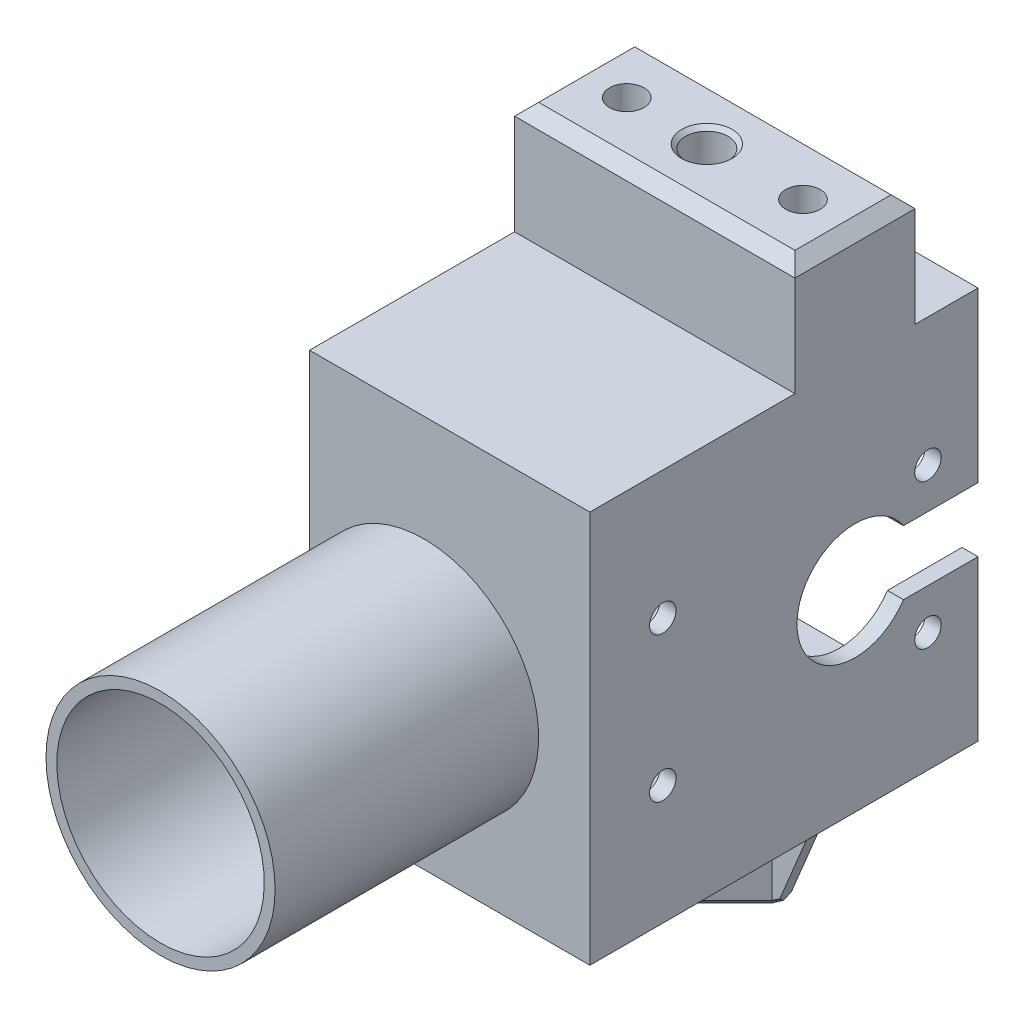
from build123d import *

# Parameters (mm, degrees)
EXTRUDE_1_DEPTH          = 46.45
CUT_EXTRUDE_2_REACH      = 65.11
SKETCH_2_R               = 7.249999999999959
SKETCH_2_R_2             = 5.749999999999962
CUT_EXTRUDE_3_REACH      = 71.748
SKETCH_3_R               = 2.2500000000000027
SKETCH_3_R_2             = 2.249999999999999
SKETCH_4_R               = 12.949999999999998
EXTRUDE_4_DEPTH          = 2
CUT_EXTRUDE_4_DEPTH      = 2
EXTRUDE_5_DEPTH          = 34.9
EXTRUDE_6_DEPTH          = 14
CUT_EXTRUDE_6_REACH      = 106.37
SKETCH_8_R               = 2.649999999999999
SKETCH_8_R_2             = 2.149999999999999
CHAMFER_1_SIZE           = 0.5
EXTRUDE_7_DEPTH          = 15
CUT_EXTRUDE_7_REACH      = 91.85
CUT_EXTRUDE_8_REACH      = 116.053
SKETCH_11_R              = 2.6499999999999995
CHAMFER_4_SIZE           = 1
EXTRUDE_8_DEPTH          = 14
CUT_EXTRUDE_9_REACH      = 94.45
CHAMFER_START            = 24.687020867
CHAMFER_7_DEPTH          = 0.339896844
CHAMFER_START_2          = -25.99805155
CHAMFER_8_DEPTH          = 0.339896844
CHAMFER_2_SIZE           = 0.25
CHAMFER_3_SIZE           = 1.5
CHAMFER_6_SIZE           = 1
SKETCH_18_W              = 15.350000000000055
SKETCH_18_H              = 7.999999999999998
CUT_EXTRUDE_10_DEPTH     = 97.96944106263581
PATTERN_CIRCULAR_1_COUNT = 4
CUT_EXTRUDE_11_REACH     = 98.969
SKETCH_19_R              = 1.650000000000008
SKETCH_19_R_2            = 1.6500000000000021
SKETCH_19_R_3            = 1.6500000000000006


with BuildPart() as part:
    # 草图1 → 凸台-拉伸1 (new body)
    with BuildSketch(Plane.XY):
        Polygon((17.5, 24.5), (17.500000000000007, -24.5), (-17.499999999999993, -24.5), (-17.499999999999996, 24.5), align=None)
        Polygon((-15.499999999999998, 22.5), (15.500000000000002, 22.5), (15.500000000000009, -22.5), (-15.499999999999995, -22.5), align=None, mode=Mode.SUBTRACT)
    extrude(amount=EXTRUDE_1_DEPTH)

    # 切除-拉伸2: up to this face of the body (flat: up to its plane)
    cut_extrude_2_end = Plane(part.part.faces().sort_by_distance((-17.5, 0, 23.225))[0])
    # 草图2 → 切除-拉伸2 (cut, up to the picked face)
    with BuildSketch(Plane(origin=(17.500000000000004, 2.48e-15, 0), x_dir=(0, 0, -1), z_dir=(1, 0, 0)), mode=Mode.PRIVATE) as cut_extrude_2_sk1:
        with Locations(Location((-15.350000000000003, -0.5500000000000251, 0), (0, 0, 90))):
            Circle(SKETCH_2_R)
        with Locations((-15.350000000000003, -0.5500000000000251)):
            Circle(SKETCH_2_R_2, mode=Mode.SUBTRACT)
    cut_extrude_2_tool1 = split(extrude(cut_extrude_2_sk1.sketch, amount=-CUT_EXTRUDE_2_REACH, mode=Mode.PRIVATE), bisect_by=cut_extrude_2_end, keep=Keep.BOTH, mode=Mode.PRIVATE)
    add(cut_extrude_2_tool1.solids().sort_by(Axis((17.5, -7.594939, 15.35), (-1, 0, 0)))[0], mode=Mode.SUBTRACT)


with BuildPart() as cut_extrude_2_kept_piece:
    # of the separate pieces the step leaves, the one the design keeps (cut_extrude_2_pieces_kept)
    add(part.part.solids().sort_by_distance((17.5, 24.5, 0))[0])

    # 草图3 → 切除-拉伸3 (cut, up to next)
    with BuildSketch(Plane.XZ.offset(24.5), mode=Mode.PRIVATE) as cut_extrude_3_sk1:
        with Locations((-8.500000000000327, 39.00000000000005)):
            Circle(SKETCH_3_R)
    cut_extrude_3_tool1 = extrude(cut_extrude_3_sk1.sketch, amount=-CUT_EXTRUDE_3_REACH, mode=Mode.PRIVATE) & cut_extrude_2_kept_piece.part
    # 草图3 → 切除-拉伸3 (cut, up to next)
    with BuildSketch(Plane.XZ.offset(24.5), mode=Mode.PRIVATE) as cut_extrude_3_sk2:
        with Locations((5.49999999999966, 39.00000000000005)):
            Circle(SKETCH_3_R)
    cut_extrude_3_tool2 = extrude(cut_extrude_3_sk2.sketch, amount=-CUT_EXTRUDE_3_REACH, mode=Mode.PRIVATE) & cut_extrude_2_kept_piece.part
    # 草图3 → 切除-拉伸3 (cut, up to next)
    with BuildSketch(Plane.XZ.offset(24.5), mode=Mode.PRIVATE) as cut_extrude_3_sk3:
        with Locations((-8.500000000000327, 6.500000000000061)):
            Circle(SKETCH_3_R_2)
    cut_extrude_3_tool3 = extrude(cut_extrude_3_sk3.sketch, amount=-CUT_EXTRUDE_3_REACH, mode=Mode.PRIVATE) & cut_extrude_2_kept_piece.part
    # 草图3 → 切除-拉伸3 (cut, up to next)
    with BuildSketch(Plane.XZ.offset(24.5), mode=Mode.PRIVATE) as cut_extrude_3_sk4:
        with Locations((5.49999999999966, 6.500000000000061)):
            Circle(SKETCH_3_R_2)
    cut_extrude_3_tool4 = extrude(cut_extrude_3_sk4.sketch, amount=-CUT_EXTRUDE_3_REACH, mode=Mode.PRIVATE) & cut_extrude_2_kept_piece.part
    add(cut_extrude_3_tool1.solids().sort_by_distance((-8.5, -24.5, 39))[0], mode=Mode.SUBTRACT)
    add(cut_extrude_3_tool2.solids().sort_by_distance((5.5, -24.5, 39))[0], mode=Mode.SUBTRACT)
    add(cut_extrude_3_tool3.solids().sort_by_distance((-8.5, -24.5, 6.5))[0], mode=Mode.SUBTRACT)
    add(cut_extrude_3_tool4.solids().sort_by_distance((5.5, -24.5, 6.5))[0], mode=Mode.SUBTRACT)

    # 草图4 → 凸台-拉伸4 (add)
    with BuildSketch(Plane.XY.offset(46.449999999999996)):
        Polygon((17.5, 24.500000000000018), (-17.5, 24.500000000000018), (-17.499999999999993, -24.499999999999982), (17.500000000000007, -24.499999999999982), align=None)
        with Locations((-3.200000000000329, -3.0499999999999856)):
            Circle(SKETCH_4_R, mode=Mode.SUBTRACT)
    extrude(amount=EXTRUDE_4_DEPTH)

    # 草图4<4> → 切除-拉伸4 (cut)
    with BuildSketch(Plane.XY.offset(46.449999999999996)):
        with BuildLine():
            Line((-15.499999999999995, -7.101234379791393), (-15.499999999999995, 1.0012343797914305))
            ThreePointArc((-15.500000000000153, 1.0012343797914554), (-16.150000000000322, -3.0499999999999834), (-15.500000000000156, -7.1012343797914195))
        make_face()
    extrude(amount=-CUT_EXTRUDE_4_DEPTH, mode=Mode.SUBTRACT)

    # 草图4<5> → 凸台-拉伸5 (add)
    with BuildSketch(Plane.XY.offset(46.449999999999996)):
        with BuildLine():
            ThreePointArc((-15.500000000000401, 4.243833011521833), (-16.990939054320602, 0.7315340802364934), (-17.49999999999914, -3.0500000000000234))
            ThreePointArc((-17.49999999999914, -3.0500000000000234), (-16.990939054320602, -6.831534080236546), (-15.5000000000004, -10.343833011521886))
            Line((-15.499999999999995, -10.343833011521788), (-15.499999999999995, -7.101234379791393))
            ThreePointArc((-15.500000000000156, -7.1012343797914195), (-16.150000000000322, -3.0499999999999834), (-15.500000000000153, 1.0012343797914554))
            Line((-15.499999999999995, 1.0012343797914305), (-15.499999999999995, 4.243833011521733))
        make_face()
        with BuildLine():
            ThreePointArc((11.099999999999373, -3.050000000000025), (0.5815340802366347, 10.740939054320695), (-15.500000000000401, 4.243833011521833))
            Line((-15.499999999999995, 4.243833011521733), (-15.499999999999995, 1.0012343797914305))
            ThreePointArc((-15.500000000000153, 1.0012343797914554), (-10.790751437825861, 7.442044253106728), (-3.2000000000003266, 9.900000000000015))
            ThreePointArc((-3.200000000000332, 9.900000000000013), (9.74999999999967, -3.0499999999999825), (-3.2000000000003297, -15.999999999999982))
            ThreePointArc((-3.200000000000337, -15.99999999999998), (-10.790751437825865, -13.542044253106688), (-15.500000000000156, -7.1012343797914195))
            Line((-15.499999999999995, -7.101234379791393), (-15.499999999999995, -10.343833011521788))
            ThreePointArc((-15.5000000000004, -10.343833011521886), (0.5815340802366369, -16.840939054320746), (11.099999999999373, -3.0500000000000287))
        make_face()
    extrude(amount=EXTRUDE_5_DEPTH)

    # 草图6 → 凸台-拉伸6 (add)
    with BuildSketch(Plane(origin=(0, 24.5, 0), x_dir=(1, 0, 0), z_dir=(0, 1, 0))):
        Polygon((-17.5, -7.850000000000228), (17.500000000000004, -7.850000000000228), (17.500000000000004, -22.85000000000023), (-17.499999999999996, -22.85000000000023), align=None)
    extrude(amount=EXTRUDE_6_DEPTH)

    # 草图8 → 切除-拉伸6 (cut, up to next)
    with BuildSketch(Plane(origin=(0, 38.5, 0), x_dir=(1, 0, 0), z_dir=(0, 1, 0)), mode=Mode.PRIVATE) as cut_extrude_6_sk1:
        with Locations(Location((-0.9999999999999315, -15.350000000000131, 0), (0, 0, 270))):
            Circle(SKETCH_8_R)
    cut_extrude_6_tool1 = extrude(cut_extrude_6_sk1.sketch, amount=-CUT_EXTRUDE_6_REACH, mode=Mode.PRIVATE) & cut_extrude_2_kept_piece.part
    # 草图8 → 切除-拉伸6 (cut, up to next)
    with BuildSketch(Plane(origin=(0, 38.5, 0), x_dir=(1, 0, 0), z_dir=(0, 1, 0)), mode=Mode.PRIVATE) as cut_extrude_6_sk2:
        with Locations(Location((11.00000000000007, -15.350000000000128, 0), (0, 0, 270))):
            Circle(SKETCH_8_R_2)
    cut_extrude_6_tool2 = extrude(cut_extrude_6_sk2.sketch, amount=-CUT_EXTRUDE_6_REACH, mode=Mode.PRIVATE) & cut_extrude_2_kept_piece.part
    # 草图8 → 切除-拉伸6 (cut, up to next)
    with BuildSketch(Plane(origin=(0, 38.5, 0), x_dir=(1, 0, 0), z_dir=(0, 1, 0)), mode=Mode.PRIVATE) as cut_extrude_6_sk3:
        with Locations(Location((-10.999999999999932, -15.350000000000128, 0), (0, 0, 270))):
            Circle(SKETCH_8_R_2)
    cut_extrude_6_tool3 = extrude(cut_extrude_6_sk3.sketch, amount=-CUT_EXTRUDE_6_REACH, mode=Mode.PRIVATE) & cut_extrude_2_kept_piece.part
    add(cut_extrude_6_tool1.solids().sort_by_distance((-1, 38.5, 15.35))[0], mode=Mode.SUBTRACT)
    add(cut_extrude_6_tool2.solids().sort_by_distance((11, 38.5, 15.35))[0], mode=Mode.SUBTRACT)
    add(cut_extrude_6_tool3.solids().sort_by_distance((-11, 38.5, 15.35))[0], mode=Mode.SUBTRACT)

    # 倒角1
    chamfer_1_edges = [cut_extrude_2_kept_piece.edges().sort_by_distance(p)[0] for p in [
        (-0.9999999999999307, 22.5, 12.700000000000133),
        (-0.9999999999999307, 38.5, 12.700000000000133),
    ]]
    chamfer(chamfer_1_edges, length=CHAMFER_1_SIZE)

    # 草图10 → 凸台-拉伸7 (add)
    with BuildSketch(Plane.XZ.offset(24.5)):
        Polygon((-0.9999999999999757, 24.8959415460183), (8.54594154601842, 15.349999999999916), (-0.9999999999999722, 5.804058453981523), (-10.545941546018366, 15.349999999999913), align=None)
    extrude(amount=EXTRUDE_7_DEPTH)

    # 草图12 → 切除-拉伸7 (cut, up to next)
    with BuildSketch(Plane(origin=(-3.4020292269907464, 3.4e-16, 3.402029226990747), x_dir=(-0.7071067811865475, 0, -0.7071067811865476), z_dir=(0.7071067811865476, 0, -0.7071067811865475)), mode=Mode.PRIVATE) as cut_extrude_7_sk1:
        Polygon((-15.14698231002692, -28.999999999999996), (-5.146982310026918, -28.999999999999996), (-5.146982310026917, -37), (-15.146982310026917, -37), align=None)
    cut_extrude_7_tool1 = extrude(cut_extrude_7_sk1.sketch, amount=-CUT_EXTRUDE_7_REACH, mode=Mode.PRIVATE) & cut_extrude_2_kept_piece.part
    add(cut_extrude_7_tool1.solids().sort_by_distance((3.772971, -33, 10.577029))[0], mode=Mode.SUBTRACT)

    # 草图11 → 切除-拉伸8 (cut, up to next)
    with BuildSketch(Plane.XZ.offset(39.5), mode=Mode.PRIVATE) as cut_extrude_8_sk1:
        with Locations(Location((-0.999999999999979, 15.34999999999991, 0), (0, 0, 90))):
            Circle(SKETCH_11_R)
    cut_extrude_8_tool1 = extrude(cut_extrude_8_sk1.sketch, amount=-CUT_EXTRUDE_8_REACH, mode=Mode.PRIVATE) & cut_extrude_2_kept_piece.part
    add(cut_extrude_8_tool1.solids().sort_by_distance((-1, -39.5, 15.35))[0], mode=Mode.SUBTRACT)

    # 倒角4
    chamfer_4_edges = [cut_extrude_2_kept_piece.edges().sort_by_distance(p)[0] for p in [
        (3.7729707730092232, -39.5, 10.57702922699072),
        (-5.772970773009172, -39.5, 20.122970773009108),
        (-5.772970773009171, -39.5, 10.577029226990717),
    ]]
    chamfer(chamfer_4_edges, length=CHAMFER_4_SIZE)

    # 草图13 → 凸台-拉伸8 (add)
    with BuildSketch(Plane.XZ.offset(24.5)):
        Polygon((-1.707106781186491, 0), (-0.2928932188134219, 0), (-0.2928932188134306, 6.511165235168065), (-0.9999999999999722, 5.804058453981523), (-1.707106781186516, 6.5111652351680664), align=None)
    extrude_8 = extrude(amount=EXTRUDE_8_DEPTH)

    # 草图14 → 切除-拉伸9 (cut, up to next)
    with BuildSketch(Plane.ZY.offset(1.7071067811864877), mode=Mode.PRIVATE) as cut_extrude_9_sk1:
        Polygon((5.804058453981532, -38.5), (5.91e-15, -24.5), (5.91e-15, -38.5), align=None)
    cut_extrude_9_tool1 = extrude(cut_extrude_9_sk1.sketch, amount=-CUT_EXTRUDE_9_REACH, mode=Mode.PRIVATE) & cut_extrude_2_kept_piece.part
    cut_extrude_9 = cut_extrude_9_tool1.solids().sort_by_distance((-1.707107, -33.833333, 1.934686))[0]
    add(cut_extrude_9, mode=Mode.SUBTRACT)

    # 倒角7: read off the stored shape, not the designer's step
    # 倒角7 outline → 倒角7 (cut)
    with BuildSketch(Plane(origin=(0, 0, 0), x_dir=(0.8741995005410046, 0.40377580995908047, 0.2697041500343415), z_dir=(0.48556691943938896, -0.7269453442262939, -0.4855669194393879)).offset(CHAMFER_START)):
        Polygon((-14.847976787, 26.210904553), (-14.047244232, 25.62881575), (-14.047244232, 26.792993356), align=None)
    chamfer_7 = extrude(amount=CHAMFER_7_DEPTH, mode=Mode.SUBTRACT)

    # 倒角8: read off the stored shape, not the designer's step
    # 倒角8 outline → 倒角8 (cut)
    with BuildSketch(Plane(origin=(0, 0, 0), x_dir=(0.8741995005410051, -0.4037758099590791, -0.2697041500343421), z_dir=(0.4855669194393881, 0.7269453442262931, 0.48556691943939007)).offset(CHAMFER_START_2)):
        Polygon((12.298845231, -26.792993356), (13.099577786, -26.210904553), (12.298845231, -25.62881575), align=None)
    chamfer_8 = extrude(amount=CHAMFER_8_DEPTH, mode=Mode.SUBTRACT)

    # 倒角2
    chamfer_2_edges = [cut_extrude_2_kept_piece.edges().sort_by_distance(p)[0] for p in [
        (-0.9999999999999784, -37, 12.69999999999991),
        (-0.9999999999999784, -39.5, 12.69999999999991),
    ]]
    chamfer(chamfer_2_edges, length=CHAMFER_2_SIZE)

    # 倒角3
    chamfer_3_edges = [cut_extrude_2_kept_piece.edges().sort_by_distance(p)[0] for p in [
        (17.500000000000004, 38.5, 15.350000000000229),
        (0, 38.5, 7.850000000000228),
        (-17.5, 38.5, 15.350000000000229),
        (3.55e-15, 38.5, 22.85000000000023),
    ]]
    chamfer(chamfer_3_edges, length=CHAMFER_3_SIZE)

    # 倒角6
    chamfer_6_edges = [cut_extrude_2_kept_piece.edges().sort_by_distance(p)[0] for p in [
        (3.772970773009223, -39.5, 20.122970773009108),
    ]]
    chamfer(chamfer_6_edges, length=CHAMFER_6_SIZE)

    # 草图18 → 切除-拉伸10 (cut, through all)
    with BuildSketch(Plane(origin=(17.500000000000004, 2.48e-15, 0), x_dir=(0, 0, -1), z_dir=(1, 1.4e-16, 0))):
        with Locations((-7.675000000000027, -0.5499999999999801)):
            Rectangle(SKETCH_18_W, SKETCH_18_H)
    extrude(amount=-CUT_EXTRUDE_10_DEPTH, mode=Mode.SUBTRACT)

    # 阵列(圆周)1: 凸台-拉伸8, 切除-拉伸9, 倒角7, 倒角8 ×4 about axis
    pattern_circular_1_axis = Axis((-1.000000000000009, 0, 15.349999999999909), (0, 1, 0))
    add([extrude_8.rotate(pattern_circular_1_axis, i * 360 / PATTERN_CIRCULAR_1_COUNT) for i in range(1, PATTERN_CIRCULAR_1_COUNT)])
    add([cut_extrude_9.rotate(pattern_circular_1_axis, i * 360 / PATTERN_CIRCULAR_1_COUNT) for i in range(1, PATTERN_CIRCULAR_1_COUNT)], mode=Mode.SUBTRACT)
    add([chamfer_7.rotate(pattern_circular_1_axis, i * 360 / PATTERN_CIRCULAR_1_COUNT) for i in range(1, PATTERN_CIRCULAR_1_COUNT)], mode=Mode.SUBTRACT)
    add([chamfer_8.rotate(pattern_circular_1_axis, i * 360 / PATTERN_CIRCULAR_1_COUNT) for i in range(1, PATTERN_CIRCULAR_1_COUNT)], mode=Mode.SUBTRACT)

    # 草图19 → 切除-拉伸11 (cut, up to next)
    with BuildSketch(Plane(origin=(17.500000000000004, 2.48e-15, 0), x_dir=(0, 0, -1), z_dir=(1, 1.4e-16, 0)), mode=Mode.PRIVATE) as cut_extrude_11_sk1:
        with Locations(Location((-6.250000000000002, 8.499999999999982, 0), (0, 0, 90))):
            Circle(SKETCH_19_R)
    cut_extrude_11_tool1 = extrude(cut_extrude_11_sk1.sketch, amount=-CUT_EXTRUDE_11_REACH, mode=Mode.PRIVATE) & cut_extrude_2_kept_piece.part
    # 草图19 → 切除-拉伸11 (cut, up to next)
    with BuildSketch(Plane(origin=(17.500000000000004, 2.48e-15, 0), x_dir=(0, 0, -1), z_dir=(1, 1.4e-16, 0)), mode=Mode.PRIVATE) as cut_extrude_11_sk2:
        with Locations(Location((-39.35, 8.49999999999997, 0), (0, 0, 90))):
            Circle(SKETCH_19_R_2)
    cut_extrude_11_tool2 = extrude(cut_extrude_11_sk2.sketch, amount=-CUT_EXTRUDE_11_REACH, mode=Mode.PRIVATE) & cut_extrude_2_kept_piece.part
    # 草图19 → 切除-拉伸11 (cut, up to next)
    with BuildSketch(Plane(origin=(17.500000000000004, 2.48e-15, 0), x_dir=(0, 0, -1), z_dir=(1, 1.4e-16, 0)), mode=Mode.PRIVATE) as cut_extrude_11_sk3:
        with Locations(Location((-39.349999999999994, -9.600000000000032, 0), (0, 0, 90))):
            Circle(SKETCH_19_R_2)
    cut_extrude_11_tool3 = extrude(cut_extrude_11_sk3.sketch, amount=-CUT_EXTRUDE_11_REACH, mode=Mode.PRIVATE) & cut_extrude_2_kept_piece.part
    # 草图19 → 切除-拉伸11 (cut, up to next)
    with BuildSketch(Plane(origin=(17.500000000000004, 2.48e-15, 0), x_dir=(0, 0, -1), z_dir=(1, 1.4e-16, 0)), mode=Mode.PRIVATE) as cut_extrude_11_sk4:
        with Locations(Location((-6.249999999999996, -9.60000000000002, 0), (0, 0, 90))):
            Circle(SKETCH_19_R_3)
    cut_extrude_11_tool4 = extrude(cut_extrude_11_sk4.sketch, amount=-CUT_EXTRUDE_11_REACH, mode=Mode.PRIVATE) & cut_extrude_2_kept_piece.part
    add(cut_extrude_11_tool1.solids().sort_by_distance((17.5, 8.5, 6.25))[0], mode=Mode.SUBTRACT)
    add(cut_extrude_11_tool2.solids().sort_by_distance((17.5, 8.5, 39.35))[0], mode=Mode.SUBTRACT)
    add(cut_extrude_11_tool3.solids().sort_by_distance((17.5, -9.6, 39.35))[0], mode=Mode.SUBTRACT)
    add(cut_extrude_11_tool4.solids().sort_by_distance((17.5, -9.6, 6.25))[0], mode=Mode.SUBTRACT)


solid = cut_extrude_2_kept_piece.part
